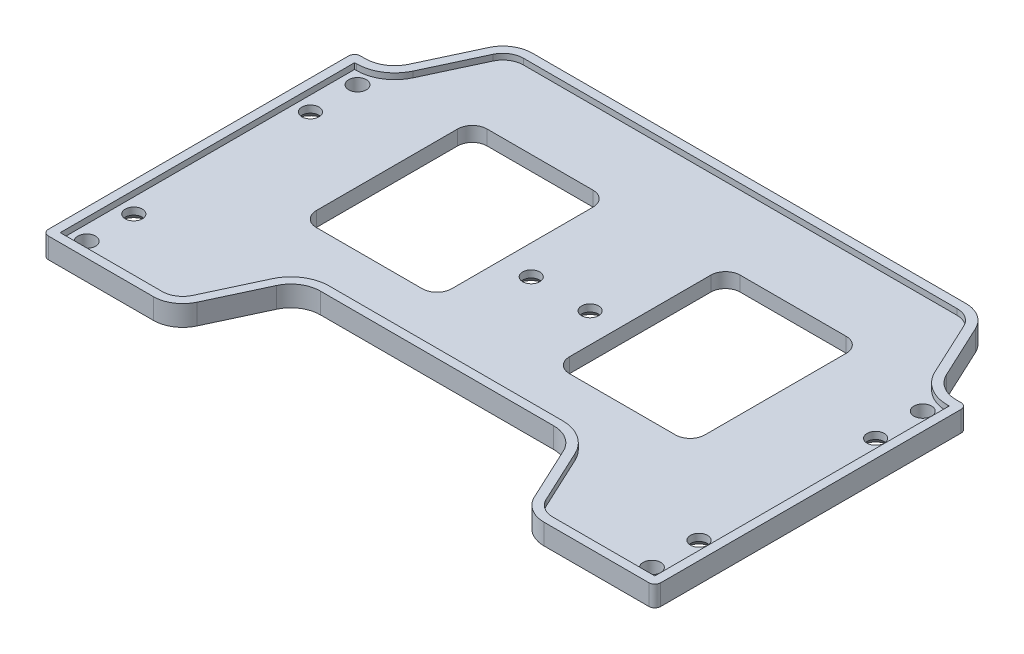
from build123d import *

# Parameters (mm, degrees)
BOSS_EXTRUDE1_DEPTH                               = 3.5
FILLET1_R                                         = 5
FILLET2_R                                         = 1
CSK_FOR_M2_5_FLAT_HEAD_MACHINE_SCREW1_D           = 2.9
CSK_FOR_M2_5_FLAT_HEAD_MACHINE_SCREW1_CSINK_D     = 5.5
CSK_FOR_M2_5_FLAT_HEAD_MACHINE_SCREW1_CSINK_ANGLE = 90
SKETCH6_R                                         = 1.5
CUT_EXTRUDE3_DEPTH                                = 75.3320254
SKETCH7_W                                         = 23
SKETCH7_H                                         = 29
CUT_EXTRUDE4_DEPTH                                = 75.3320254
FILLET3_R                                         = 2.5
FILLET1_OF_MIRROR1_R                              = 5
FILLET2_OF_MIRROR1_R                              = 1
FILLET3_OF_MIRROR1_R                              = 2.5
CUT_EXTRUDE2_DEPTH                                = 1


with BuildPart() as part:
    # Sketch1 → Boss-Extrude1 (new body)
    with BuildSketch(Plane(origin=(0, 0, 0), x_dir=(1, 0, 0), z_dir=(0, 1, 0))):
        Polygon((0, 0), (23, 0), (30, -15), (52, -15), (52, 38), (47, 38), (40, 53), (0, 53), align=None)
    boss_extrude1 = extrude(amount=BOSS_EXTRUDE1_DEPTH)

    # Fillet1
    fillet1_edges = [part.edges().sort_by_distance(p)[0] for p in [
        (47, 1.75, -38),
        (40, 1.75, -53),
        (30, 1.75, 15),
        (23, 1.75, 0),
    ]]
    fillet(fillet1_edges, radius=FILLET1_R)

    # Fillet2
    fillet2_edges = [part.edges().sort_by_distance(p)[0] for p in [
        (52, 1.75, 15),
        (52, 1.75, -38),
    ]]
    fillet(fillet2_edges, radius=FILLET2_R)

    # CSK for M2.5 Flat Head Machine Screw1 (through all)
    with Locations(Plane(origin=(0, 0, 0), x_dir=(-1, 0, 0), z_dir=(0, -1, 0))):
        with Locations((-5, 21), (-48, -3.5), (-48, 26.5)):
            csk_for_m2_5_flat_head_machine_screw1 = CounterSinkHole(CSK_FOR_M2_5_FLAT_HEAD_MACHINE_SCREW1_D / 2, CSK_FOR_M2_5_FLAT_HEAD_MACHINE_SCREW1_CSINK_D / 2, counter_sink_angle=CSK_FOR_M2_5_FLAT_HEAD_MACHINE_SCREW1_CSINK_ANGLE)

    # Sketch6 → Cut-Extrude3 (cut, through all)
    with BuildSketch(Plane.XZ):
        with Locations((48, 11.5)):
            Circle(SKETCH6_R)
        with Locations((48, -34.5)):
            Circle(SKETCH6_R)
    cut_extrude3 = extrude(amount=-CUT_EXTRUDE3_DEPTH, mode=Mode.SUBTRACT)

    # Sketch7 → Cut-Extrude4 (cut, through all)
    with BuildSketch(Plane(origin=(0, 3.5, 0), x_dir=(1, 0, 0), z_dir=(0, 1, 0))):
        with Locations((21.5, 24.5)):
            Rectangle(SKETCH7_W, SKETCH7_H)
    cut_extrude4 = extrude(amount=-CUT_EXTRUDE4_DEPTH, mode=Mode.SUBTRACT)

    # Fillet3
    fillet3_edges = [part.edges().sort_by_distance(p)[0] for p in [
        (33, 1.75, -39),
        (33, 1.75, -10),
        (10, 1.75, -10),
        (10, 1.75, -39),
    ]]
    fillet(fillet3_edges, radius=FILLET3_R)

    # Mirror1: Boss-Extrude1, CSK for M2.5 Flat Head Machine Screw1, Cut-Extrude3, Cut-Extrude4 across plane
    add(boss_extrude1.mirror(Plane(origin=(0, 0, 0), x_dir=(0, 0, 1), z_dir=(1, 0, 0))))
    add(csk_for_m2_5_flat_head_machine_screw1.mirror(Plane(origin=(0, 0, 0), x_dir=(0, 0, 1), z_dir=(1, 0, 0))), mode=Mode.SUBTRACT)
    add(cut_extrude3.mirror(Plane(origin=(0, 0, 0), x_dir=(0, 0, 1), z_dir=(1, 0, 0))), mode=Mode.SUBTRACT)
    add(cut_extrude4.mirror(Plane(origin=(0, 0, 0), x_dir=(0, 0, 1), z_dir=(1, 0, 0))), mode=Mode.SUBTRACT)

    # Fillet1 of Mirror1
    fillet1_of_mirror1_edges = [part.edges().sort_by_distance(p)[0] for p in [
        (-47, 1.75, -38),
        (-40, 1.75, -53),
        (-30, 1.75, 15),
        (-23, 1.75, 0),
    ]]
    fillet(fillet1_of_mirror1_edges, radius=FILLET1_OF_MIRROR1_R)

    # Fillet2 of Mirror1
    fillet2_of_mirror1_edges = [part.edges().sort_by_distance(p)[0] for p in [
        (-52, 1.75, 15),
        (-52, 1.75, -38),
    ]]
    fillet(fillet2_of_mirror1_edges, radius=FILLET2_OF_MIRROR1_R)

    # Fillet3 of Mirror1
    fillet3_of_mirror1_edges = [part.edges().sort_by_distance(p)[0] for p in [
        (-33, 1.75, -39),
        (-33, 1.75, -10),
        (-10, 1.75, -10),
        (-10, 1.75, -39),
    ]]
    fillet(fillet3_of_mirror1_edges, radius=FILLET3_OF_MIRROR1_R)

    # Sketch2 → Cut-Extrude2 (cut)
    with BuildSketch(Plane(origin=(0, 3.5, 0), x_dir=(1, 0, 0), z_dir=(0, 1, 0))):
        with BuildLine():
            Line((-50.5, 36.5), (-50.5, -13.5))
            Line((-50.5, -13.5), (-33.184315119, -13.5))
            ThreePointArc((-33.184315119, -13.5), (-31.304201685, -12.952147265), (-30.012674129, -11.480099129))
            Line((-30.012674129, -11.480099129), (-25.705875291, -2.251244475))
            ThreePointArc((-25.705875291, -2.251244475), (-23.307324116, 0.482559207), (-19.815684881, 1.5))
            Line((-19.815684881, 1.5), (19.815684881, 1.5))
            ThreePointArc((19.815684881, 1.5), (23.307324116, 0.482559207), (25.705875291, -2.251244475))
            Line((25.705875291, -2.251244475), (30.012674129, -11.480099129))
            ThreePointArc((30.012674129, -11.480099129), (31.304201685, -12.952147265), (33.184315119, -13.5))
            Line((33.184315119, -13.5), (50.5, -13.5))
            Line((50.5, -13.5), (50.5, 36.5))
            Line((50.5, 36.5), (50.184315119, 36.5))
            ThreePointArc((50.184315119, 36.5), (46.692675884, 37.517440793), (44.294124709, 40.251244475))
            Line((44.294124709, 40.251244475), (39.987325871, 49.480099129))
            ThreePointArc((39.987325871, 49.480099129), (38.695798315, 50.952147265), (36.815684881, 51.5))
            Line((36.815684881, 51.5), (-36.815684881, 51.5))
            ThreePointArc((-36.815684881, 51.5), (-38.695798315, 50.952147265), (-39.987325871, 49.480099129))
            Line((-39.987325871, 49.480099129), (-44.294124709, 40.251244475))
            ThreePointArc((-44.294124709, 40.251244475), (-46.692675884, 37.517440793), (-50.184315119, 36.5))
            Line((-50.184315119, 36.5), (-50.5, 36.5))
        make_face()
    extrude(amount=-CUT_EXTRUDE2_DEPTH, mode=Mode.SUBTRACT)


solid = part.part
